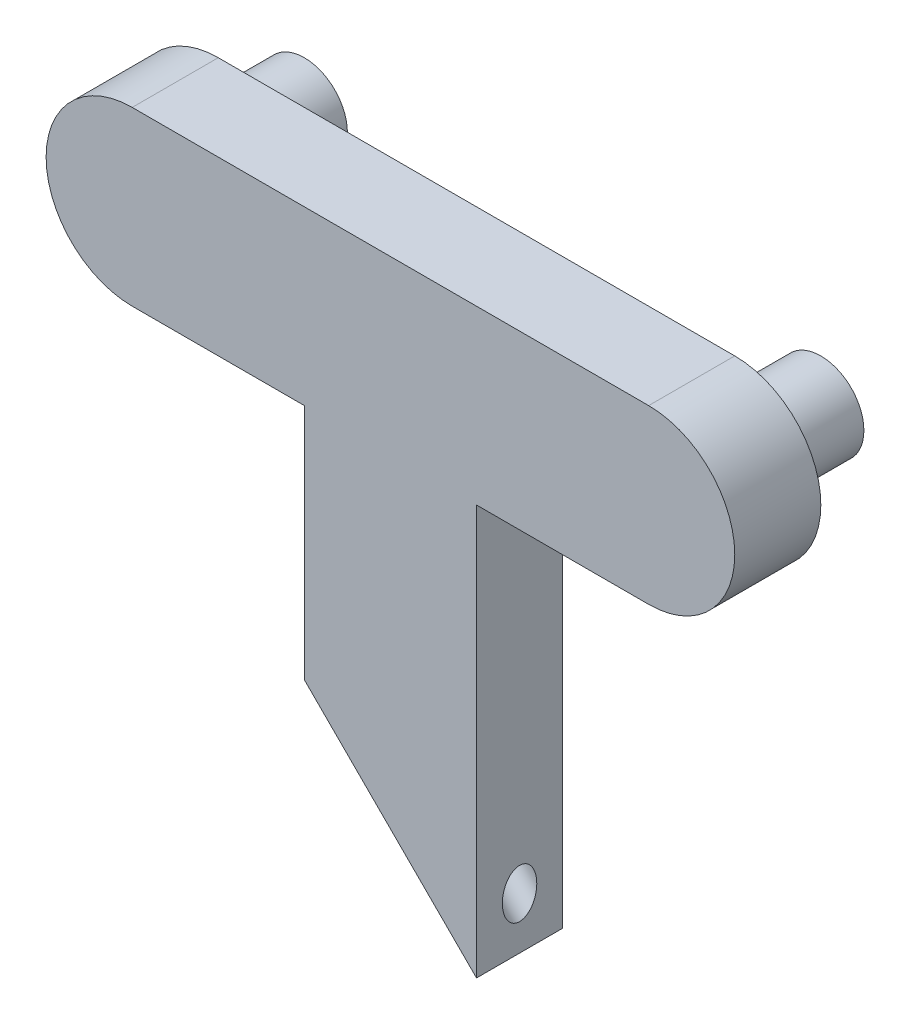
from build123d import *

# Parameters (mm, degrees)
ESTRUSIONE_ESTRUSIONE3_DEPTH = 5
SCHIZZO3_R                   = 2.5
ESTRUSIONE_ESTRUSIONE4_DEPTH = 5
TAGLIO_ESTRUSIONE1_REACH     = 44.902
SCHIZZO6_R                   = 1


with BuildPart() as part:
    # Schizzo1 → Estrusione-Estrusione3 (new body)
    with BuildSketch(Plane.XY):
        with BuildLine():
            Line((-13.207991803, 5), (16.792008197, 5))
            ThreePointArc((16.792008197, 5), (21.792008197, 0), (16.792008197, -5))
            Line((16.792008197, -5), (6.792008197, -5))
            Line((6.792008197, -5), (6.792008197, -18.794102079))
            Line((6.792008197, -18.794102079), (6.792008197, -28.794102079))
            Line((6.792008197, -28.794102079), (-3.207991803, -18.794102079))
            Line((-3.207991803, -18.794102079), (-3.207991803, -5))
            Line((-3.207991803, -5), (-13.207991803, -5))
            ThreePointArc((-13.207991803, -5), (-18.207991803, 0), (-13.207991803, 5))
        make_face()
    extrude(amount=ESTRUSIONE_ESTRUSIONE3_DEPTH)

    # Schizzo3 → Estrusione-Estrusione4 (add)
    with BuildSketch(Plane(origin=(0, 0, 0), x_dir=(-1, 0, 0), z_dir=(0, 0, -1))):
        with Locations((-16.792008197, 0)):
            Circle(SCHIZZO3_R)
        with Locations((13.207991803, 0)):
            Circle(SCHIZZO3_R)
    extrude(amount=ESTRUSIONE_ESTRUSIONE4_DEPTH)

    # Taglio-Estrusione1: up to this plane
    taglio_estrusione1_end = Plane(origin=(-3.207991803, -5, 5), z_dir=(1, 0, 0))
    # Schizzo6 → Taglio-Estrusione1 (cut, up to the surface)
    with BuildSketch(Plane(origin=(17.793055138, -17.793055138, 0), x_dir=(0, 0, -1), z_dir=(-0.7071067811865562, 0.7071067811865389, 0)), mode=Mode.PRIVATE) as taglio_estrusione1_sk1:
        with Locations((-2.5, 13.435479888)):
            Circle(SCHIZZO6_R)
    taglio_estrusione1_tool1 = split(extrude(taglio_estrusione1_sk1.sketch, amount=TAGLIO_ESTRUSIONE1_REACH, mode=Mode.PRIVATE), bisect_by=taglio_estrusione1_end, keep=Keep.BOTH, mode=Mode.PRIVATE)
    add(taglio_estrusione1_tool1.solids().sort_by_distance((8.292736, -27.293374, 2.5))[0], mode=Mode.SUBTRACT)


solid = part.part
